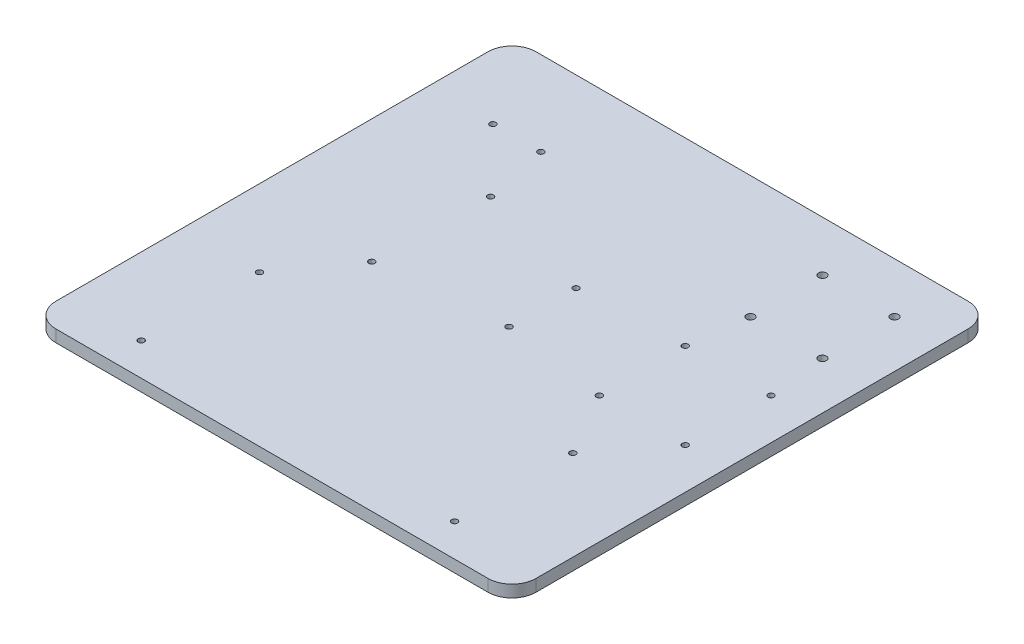
from build123d import *

# Parameters (mm, degrees)
BOSS_EXTRUDE1_DEPTH            = 5
ARDUINO_UNO_HOLES_D            = 2.5
RELAY_BOARD_HOLES_D            = 2.5
L298N_HOLES_D                  = 2.5
MOTOR_MOUNTING_BRACKET_HOLES_D = 3.3
BT_MOUNT_HOLES_D               = 2.5


with BuildPart() as part:
    # Sketch1 → Boss-Extrude1 (new body)
    with BuildSketch(Plane(origin=(0, 0, 0), x_dir=(1, 0, 0), z_dir=(0, 1, 0))):
        with BuildLine():
            Line((-90, -100), (90, -100))
            ThreePointArc((90, -100), (97.071067812, -97.071067812), (100, -90))
            Line((100, -90), (100, 90))
            ThreePointArc((100, 90), (97.071067812, 97.071067812), (90, 100))
            Line((90, 100), (-90, 100))
            ThreePointArc((-90, 100), (-97.071067812, 97.071067812), (-100, 90))
            Line((-100, 90), (-100, -90))
            ThreePointArc((-100, -90), (-97.071067812, -97.071067812), (-90, -100))
        make_face()
    extrude(amount=BOSS_EXTRUDE1_DEPTH)

    # arduino uno holes (through all)
    with Locations(Plane(origin=(0, 5, 0), x_dir=(1, 0, 0), z_dir=(0, 1, 0))):
        with Locations((3.609044644, 23.054858909), (3.609044644, -4.845141091), (-47.190955356, 38.254858909), (-48.490955356, -9.945141091)):
            Hole(ARDUINO_UNO_HOLES_D / 2)

    # relay board holes (through all)
    with Locations(Plane(origin=(0, 5, 0), x_dir=(1, 0, 0), z_dir=(0, 1, 0))):
        with Locations((-68.054547486, -86.37933172), (62.445452514, -86.37933172), (62.445452514, -37.12933172), (-68.054547486, -37.12933172)):
            Hole(RELAY_BOARD_HOLES_D / 2)

    # l298n holes (through all)
    with Locations(Plane(origin=(0, 5, 0), x_dir=(1, 0, 0), z_dir=(0, 1, 0))):
        with Locations((47.201873377, -10.822145301), (82.961873377, -10.822145301), (82.961873377, 24.937854699), (47.201873377, 24.937854699)):
            Hole(L298N_HOLES_D / 2)

    # motor mounting bracket holes (through all)
    with Locations(Plane(origin=(0, 5, 0), x_dir=(1, 0, 0), z_dir=(0, 1, 0))):
        with Locations((50.273035044, 49.043134243), (80.273035044, 49.043134243), (80.273035044, 79.043134243), (50.273035044, 79.043134243)):
            Hole(MOTOR_MOUNTING_BRACKET_HOLES_D / 2)

    # bt mount holes (through all)
    with Locations(Plane(origin=(0, 5, 0), x_dir=(1, 0, 0), z_dir=(0, 1, 0))):
        with Locations((-72.874556507, 64.900827736), (-52.874556507, 64.900827736)):
            Hole(BT_MOUNT_HOLES_D / 2)


solid = part.part
